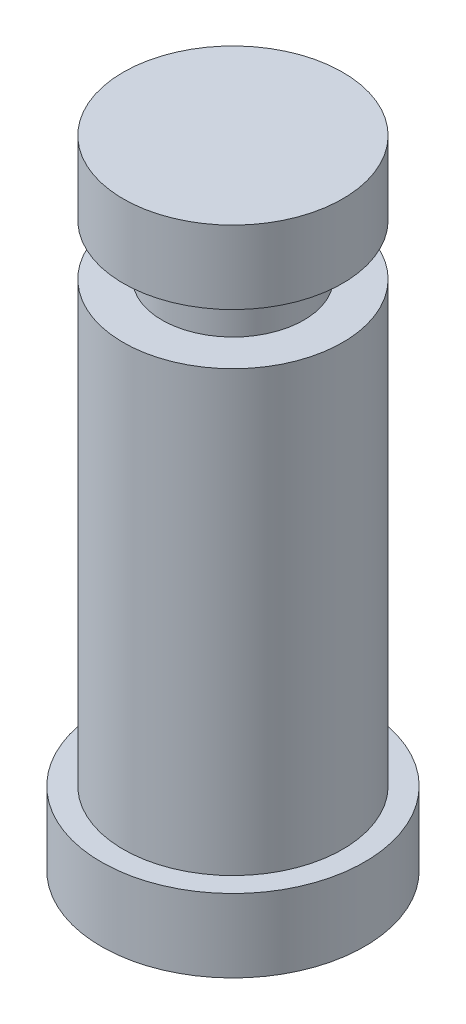
from build123d import *

# Parameters (mm, degrees)
SKETCH2_W = 2.65
SKETCH2_H = 3.5


with BuildPart() as part:
    # Sketch1 → Revolve1 (revolve)
    with BuildSketch(Plane.XY):
        Polygon((0, 0), (9, 0), (9, 5), (7.5, 5), (7.5, 43.5), (0, 43.5), align=None)
    revolve(axis=Axis((0, 48.5, 0), (0, -1, 0)))

    # Sketch2 → Cut-Revolve1 (revolve, cut)
    with BuildSketch(Plane.XY):
        with Locations((6.175, 36.75)):
            Rectangle(SKETCH2_W, SKETCH2_H)
    revolve(axis=Axis((0, 43.5, 0), (0, -1, 0)), mode=Mode.SUBTRACT)


solid = part.part
